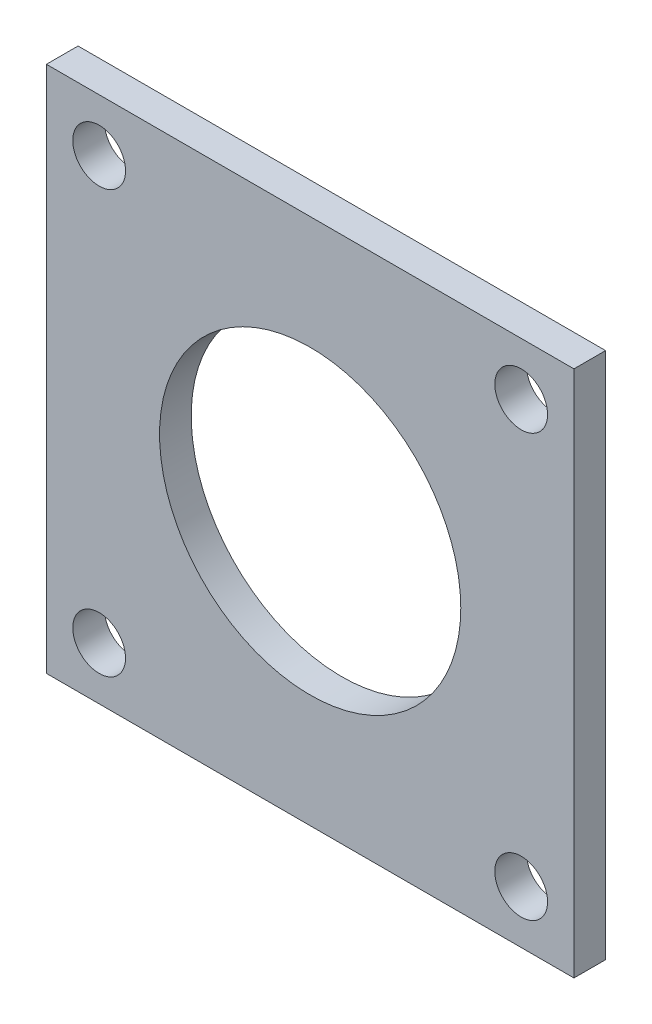
from build123d import *

# Parameters (mm, degrees)
SKETCH1_W           = 50
SKETCH1_H           = 50
BOSS_EXTRUDE1_DEPTH = 3
SKETCH2_R           = 14.275
SKETCH2_R_2         = 2.5
CUT_EXTRUDE1_DEPTH  = 3


with BuildPart() as part:
    # Sketch1 → Boss-Extrude1 (new body)
    with BuildSketch(Plane.XY):
        with Locations((25, 25)):
            Rectangle(SKETCH1_W, SKETCH1_H)
    extrude(amount=BOSS_EXTRUDE1_DEPTH)

    # Sketch2 → Cut-Extrude1 (cut)
    with BuildSketch(Plane.XY.offset(3)):
        with Locations((25, 25)):
            Circle(SKETCH2_R)
        with Locations((5, 45)):
            Circle(SKETCH2_R_2)
        with Locations((5, 5)):
            Circle(SKETCH2_R_2)
        with Locations((45, 45)):
            Circle(SKETCH2_R_2)
        with Locations((45, 5)):
            Circle(SKETCH2_R_2)
    extrude(amount=-CUT_EXTRUDE1_DEPTH, mode=Mode.SUBTRACT)


solid = part.part
